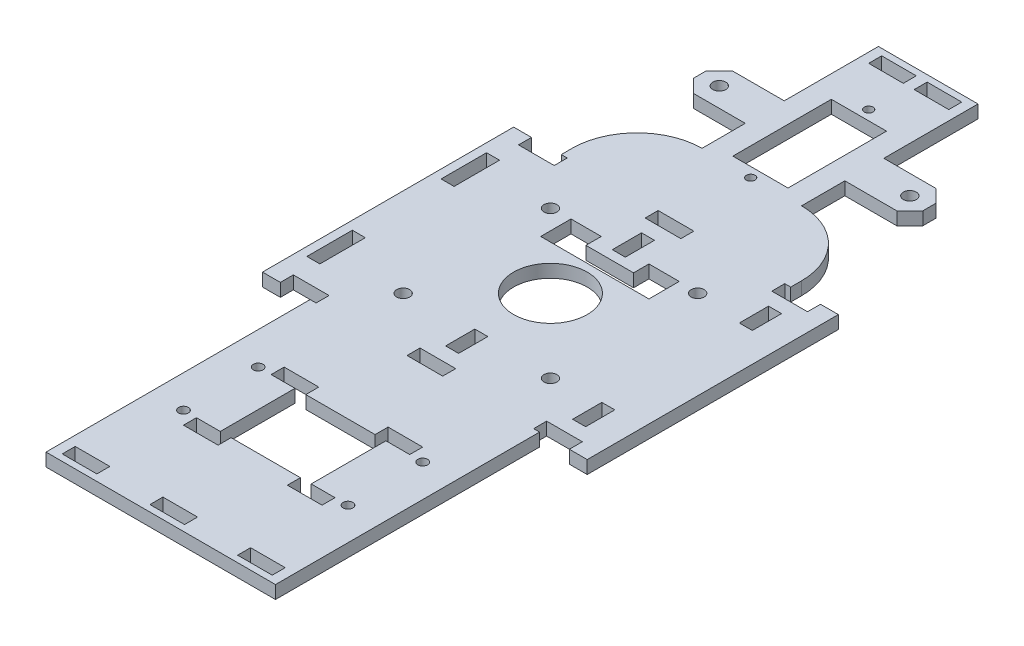
from build123d import *

# Parameters (mm, degrees)
SKETCH1_W            = 53
SKETCH1_H            = 153
BOSS_EXTRUDE1_DEPTH  = 3
SKETCH2_R            = 1.125
CUT_EXTRUDE1_DEPTH   = 3
SKETCH4_W            = 58
SKETCH4_H            = 3
BOSS_EXTRUDE3_DEPTH  = 4.5
SKETCH5_W            = 58
SKETCH5_H            = 3
BOSS_EXTRUDE4_DEPTH  = 4.5
SKETCH8_W            = 15
SKETCH8_H            = 13.5
CUT_EXTRUDE3_DEPTH   = 3
SKETCH9_W            = 6
SKETCH9_H            = 9
CUT_EXTRUDE4_DEPTH   = 3
SKETCH10_W           = 15
SKETCH10_H           = 10
CUT_EXTRUDE5_DEPTH   = 3
SKETCH11_W           = 12.75
SKETCH11_H           = 22.75
CUT_EXTRUDE6_DEPTH   = 3
SKETCH12_R           = 1
CUT_EXTRUDE7_DEPTH   = 3
SKETCH17_W           = 9
SKETCH17_H           = 3
BOSS_EXTRUDE6_DEPTH  = 6
SKETCH18_W           = 9
SKETCH18_H           = 3
BOSS_EXTRUDE8_DEPTH  = 6
SKETCH19_R           = 1.5
CUT_EXTRUDE11_DEPTH  = 3
SKETCH20_W           = 58
SKETCH20_H           = 3
BOSS_EXTRUDE9_DEPTH  = 6.5
SKETCH21_W           = 58
SKETCH21_H           = 3
BOSS_EXTRUDE10_DEPTH = 6.5
SKETCH29_W           = 8
SKETCH29_H           = 3
CUT_EXTRUDE15_DEPTH  = 3
SKETCH33_W           = 21
SKETCH33_H           = 17.25
CUT_EXTRUDE20_DEPTH  = 3
CHAMFER1_SIZE        = 3
CHAMFER2_SIZE        = 3
CHAMFER3_SIZE        = 3
CHAMFER4_SIZE        = 3
SKETCH34_W           = 8.25
SKETCH34_H           = 3
CUT_EXTRUDE21_DEPTH  = 3
SKETCH35_W           = 3
SKETCH35_H           = 6.75
CUT_EXTRUDE22_DEPTH  = 3
SKETCH36_W           = 3
SKETCH36_H           = 6.75
CUT_EXTRUDE23_DEPTH  = 3
SKETCH37_W           = 3
SKETCH37_H           = 10.5
CUT_EXTRUDE24_DEPTH  = 3
FILLET1_R            = 15
FILLET2_R            = 15
SKETCH38_W           = 23
SKETCH38_H           = 3
BOSS_EXTRUDE12_DEPTH = 8.25
SKETCH39_W           = 8
SKETCH39_H           = 3
CUT_EXTRUDE25_DEPTH  = 3
SKETCH40_W           = 53
SKETCH40_H           = 3
BOSS_EXTRUDE13_DEPTH = 16
SKETCH41_W           = 8
SKETCH41_H           = 3
CUT_EXTRUDE26_DEPTH  = 3
SKETCH42_R           = 8.5
SKETCH42_R_2         = 1.5
CUT_EXTRUDE30_DEPTH  = 3


with BuildPart() as part:
    # Sketch1 → Boss-Extrude1 (new body)
    with BuildSketch(Plane(origin=(0, 0, 0), x_dir=(1, 0, 0), z_dir=(0, 1, 0))):
        with Locations((13.558181818, 0)):
            Rectangle(SKETCH1_W, SKETCH1_H)
    extrude(amount=BOSS_EXTRUDE1_DEPTH)

    # Sketch2 → Cut-Extrude1 (cut)
    with BuildSketch(Plane(origin=(0, 3, 0), x_dir=(1, 0, 0), z_dir=(0, 1, 0))):
        with Locations(Location((-5.441818182, -68.25, 0), (0, 0, 270))):
            Circle(SKETCH2_R)
        with Locations(Location((-5.441818182, -51, 0), (0, 0, 270))):
            Circle(SKETCH2_R)
        with Locations(Location((32.558181818, -68.25, 0), (0, 0, 270))):
            Circle(SKETCH2_R)
        with Locations(Location((32.558181818, -51, 0), (0, 0, 270))):
            Circle(SKETCH2_R)
    extrude(amount=-CUT_EXTRUDE1_DEPTH, mode=Mode.SUBTRACT)

    # Sketch4 → Boss-Extrude3 (add)
    with BuildSketch(Plane(origin=(40.058181818, 0, 0), x_dir=(0, 0, -1), z_dir=(1, 0, 0))):
        with Locations((-2.5, 1.5)):
            Rectangle(SKETCH4_W, SKETCH4_H)
    extrude(amount=BOSS_EXTRUDE3_DEPTH)

    # Sketch5 → Boss-Extrude4 (add)
    with BuildSketch(Plane.ZY.offset(12.941818182)):
        with Locations((2.5, 1.5)):
            Rectangle(SKETCH5_W, SKETCH5_H)
    extrude(amount=BOSS_EXTRUDE4_DEPTH)

    # Sketch8 → Cut-Extrude3 (cut)
    with BuildSketch(Plane(origin=(0, 3, 0), x_dir=(1, 0, 0), z_dir=(0, 1, 0))):
        with Locations((-5.441818182, 69.75)):
            Rectangle(SKETCH8_W, SKETCH8_H)
        with Locations((32.558181818, 69.75)):
            Rectangle(SKETCH8_W, SKETCH8_H)
    extrude(amount=-CUT_EXTRUDE3_DEPTH, mode=Mode.SUBTRACT)

    # Sketch9 → Cut-Extrude4 (cut)
    with BuildSketch(Plane(origin=(0, 3, 0), x_dir=(1, 0, 0), z_dir=(0, 1, 0))):
        with Locations((-9.941818182, 58.5)):
            Rectangle(SKETCH9_W, SKETCH9_H)
        with Locations((37.058181818, 58.5)):
            Rectangle(SKETCH9_W, SKETCH9_H)
    extrude(amount=-CUT_EXTRUDE4_DEPTH, mode=Mode.SUBTRACT)

    # Sketch10 → Cut-Extrude5 (cut)
    with BuildSketch(Plane(origin=(0, 3, 0), x_dir=(1, 0, 0), z_dir=(0, 1, 0))):
        with Locations((-5.441818182, 49)):
            Rectangle(SKETCH10_W, SKETCH10_H)
        with Locations((32.558181818, 49)):
            Rectangle(SKETCH10_W, SKETCH10_H)
    extrude(amount=-CUT_EXTRUDE5_DEPTH, mode=Mode.SUBTRACT)

    # Sketch11 → Cut-Extrude6 (cut)
    with BuildSketch(Plane(origin=(0, 3, 0), x_dir=(1, 0, 0), z_dir=(0, 1, 0))):
        with Locations((13.558181818, 57.375)):
            Rectangle(SKETCH11_W, SKETCH11_H)
    extrude(amount=-CUT_EXTRUDE6_DEPTH, mode=Mode.SUBTRACT)

    # Sketch12 → Cut-Extrude7 (cut)
    with BuildSketch(Plane(origin=(0, 3, 0), x_dir=(1, 0, 0), z_dir=(0, 1, 0))):
        with Locations(Location((13.558181818, 71, 0), (0, 0, 270))):
            Circle(SKETCH12_R)
        with Locations(Location((13.558181818, 43.75, 0), (0, 0, 270))):
            Circle(SKETCH12_R)
    extrude(amount=-CUT_EXTRUDE7_DEPTH, mode=Mode.SUBTRACT)

    # Sketch17 → Boss-Extrude6 (add)
    with BuildSketch(Plane.ZY.offset(6.941818182)):
        with Locations((-58.5, 1.5)):
            Rectangle(SKETCH17_W, SKETCH17_H)
    extrude(amount=BOSS_EXTRUDE6_DEPTH)

    # Sketch18 → Boss-Extrude8 (add)
    with BuildSketch(Plane(origin=(34.058181818, 0, 0), x_dir=(0, 0, -1), z_dir=(1, 0, 0))):
        with Locations((58.5, 1.5)):
            Rectangle(SKETCH18_W, SKETCH18_H)
    extrude(amount=BOSS_EXTRUDE8_DEPTH)

    # Sketch19 → Cut-Extrude11 (cut)
    with BuildSketch(Plane(origin=(0, 3, 0), x_dir=(1, 0, 0), z_dir=(0, 1, 0))):
        with Locations(Location((35.558181818, 58.5, 0), (0, 0, 270))):
            Circle(SKETCH19_R)
        with Locations(Location((-8.441818182, 58.5, 0), (0, 0, 270))):
            Circle(SKETCH19_R)
    extrude(amount=-CUT_EXTRUDE11_DEPTH, mode=Mode.SUBTRACT)

    # Sketch20 → Boss-Extrude9 (add)
    with BuildSketch(Plane(origin=(44.558181818, 0, 0), x_dir=(0, 0, -1), z_dir=(1, 0, 0))):
        with Locations((-2.5, 1.5)):
            Rectangle(SKETCH20_W, SKETCH20_H)
    extrude(amount=BOSS_EXTRUDE9_DEPTH)

    # Sketch21 → Boss-Extrude10 (add)
    with BuildSketch(Plane.ZY.offset(17.441818182)):
        with Locations((2.5, 1.5)):
            Rectangle(SKETCH21_W, SKETCH21_H)
    extrude(amount=BOSS_EXTRUDE10_DEPTH)

    # Sketch29 → Cut-Extrude15 (cut)
    with BuildSketch(Plane(origin=(0, 3, 0), x_dir=(1, 0, 0), z_dir=(0, 1, 0))):
        with Locations((1.558181818, -49.5)):
            Rectangle(SKETCH29_W, SKETCH29_H)
        with Locations((1.558181818, -69.75)):
            Rectangle(SKETCH29_W, SKETCH29_H)
        with Locations((25.558181818, -49.5)):
            Rectangle(SKETCH29_W, SKETCH29_H)
        with Locations((25.558181818, -69.75)):
            Rectangle(SKETCH29_W, SKETCH29_H)
    extrude(amount=-CUT_EXTRUDE15_DEPTH, mode=Mode.SUBTRACT)

    # Sketch33 → Cut-Extrude20 (cut)
    with BuildSketch(Plane(origin=(0, 3, 0), x_dir=(1, 0, 0), z_dir=(0, 1, 0))):
        with Locations((13.558181818, -59.625)):
            Rectangle(SKETCH33_W, SKETCH33_H)
    extrude(amount=-CUT_EXTRUDE20_DEPTH, mode=Mode.SUBTRACT)

    # Chamfer1
    chamfer1_edges = [part.edges().sort_by_distance(p)[0] for p in [
        (-12.941818182, 1.5, -54),
    ]]
    chamfer(chamfer1_edges, length=CHAMFER1_SIZE)

    # Chamfer2
    chamfer2_edges = [part.edges().sort_by_distance(p)[0] for p in [
        (-12.941818182, 1.5, -63),
    ]]
    chamfer(chamfer2_edges, length=CHAMFER2_SIZE)

    # Chamfer3
    chamfer3_edges = [part.edges().sort_by_distance(p)[0] for p in [
        (40.058181818, 1.5, -54),
    ]]
    chamfer(chamfer3_edges, length=CHAMFER3_SIZE)

    # Chamfer4
    chamfer4_edges = [part.edges().sort_by_distance(p)[0] for p in [
        (40.058181818, 1.5, -63),
    ]]
    chamfer(chamfer4_edges, length=CHAMFER4_SIZE)

    # Sketch34 → Cut-Extrude21 (cut)
    with BuildSketch(Plane(origin=(0, 3, 0), x_dir=(1, 0, 0), z_dir=(0, 1, 0))):
        with Locations((-15.691818182, 25)):
            Rectangle(SKETCH34_W, SKETCH34_H)
        with Locations((42.808181818, 25)):
            Rectangle(SKETCH34_W, SKETCH34_H)
        with Locations((-15.691818182, -30)):
            Rectangle(SKETCH34_W, SKETCH34_H)
        with Locations((42.808181818, -30)):
            Rectangle(SKETCH34_W, SKETCH34_H)
        with Locations((13.558181818, -30)):
            Rectangle(SKETCH34_W, SKETCH34_H)
        with Locations((13.558181818, 25)):
            Rectangle(SKETCH34_W, SKETCH34_H)
    extrude(amount=-CUT_EXTRUDE21_DEPTH, mode=Mode.SUBTRACT)

    # Sketch35 → Cut-Extrude22 (cut)
    with BuildSketch(Plane(origin=(0, 3, 0), x_dir=(1, 0, 0), z_dir=(0, 1, 0))):
        with Locations((42.808181818, 16.75)):
            Rectangle(SKETCH35_W, SKETCH35_H)
        with Locations((42.808181818, -21.75)):
            Rectangle(SKETCH35_W, SKETCH35_H)
    extrude(amount=-CUT_EXTRUDE22_DEPTH, mode=Mode.SUBTRACT)

    # Sketch36 → Cut-Extrude23 (cut)
    with BuildSketch(Plane(origin=(0, 3, 0), x_dir=(1, 0, 0), z_dir=(0, 1, 0))):
        with Locations((13.474653765, 16.75)):
            Rectangle(SKETCH36_W, SKETCH36_H)
        with Locations((13.474653765, -21.75)):
            Rectangle(SKETCH36_W, SKETCH36_H)
    extrude(amount=-CUT_EXTRUDE23_DEPTH, mode=Mode.SUBTRACT)

    # Sketch37 → Cut-Extrude24 (cut)
    with BuildSketch(Plane(origin=(0, 3, 0), x_dir=(1, 0, 0), z_dir=(0, 1, 0))):
        with Locations((-20.441818182, 13)):
            Rectangle(SKETCH37_W, SKETCH37_H)
        with Locations((-20.441818182, -18)):
            Rectangle(SKETCH37_W, SKETCH37_H)
    extrude(amount=-CUT_EXTRUDE24_DEPTH, mode=Mode.SUBTRACT)

    # Fillet1
    fillet1_edges = [part.edges().sort_by_distance(p)[0] for p in [
        (-12.941818182, 1.5, -44),
    ]]
    fillet(fillet1_edges, radius=FILLET1_R - 0.0001)  # a hair under: the kernel refuses the full size

    # Fillet2
    fillet2_edges = [part.edges().sort_by_distance(p)[0] for p in [
        (40.058181818, 1.5, -44),
    ]]
    fillet(fillet2_edges, radius=FILLET2_R - 0.0001)  # a hair under: the kernel refuses the full size

    # Sketch38 → Boss-Extrude12 (add)
    with BuildSketch(Plane(origin=(0, 0, -76.5), x_dir=(-1, 0, 0), z_dir=(0, 0, -1))):
        with Locations((-13.558181818, 1.5)):
            Rectangle(SKETCH38_W, SKETCH38_H)
    extrude(amount=BOSS_EXTRUDE12_DEPTH)

    # Sketch39 → Cut-Extrude25 (cut)
    with BuildSketch(Plane(origin=(0, 0, 0), x_dir=(-1, 0, 0), z_dir=(0, -1, 0))):
        with Locations((-8.308181818, 81.75)):
            Rectangle(SKETCH39_W, SKETCH39_H)
        with Locations((-18.808181818, 81.75)):
            Rectangle(SKETCH39_W, SKETCH39_H)
    extrude(amount=-CUT_EXTRUDE25_DEPTH, mode=Mode.SUBTRACT)

    # Sketch40 → Boss-Extrude13 (add)
    with BuildSketch(Plane.XY.offset(76.5)):
        with Locations((13.558181818, 1.5)):
            Rectangle(SKETCH40_W, SKETCH40_H)
    extrude(amount=BOSS_EXTRUDE13_DEPTH)

    # Sketch41 → Cut-Extrude26 (cut)
    with BuildSketch(Plane(origin=(0, 3, 0), x_dir=(1, 0, 0), z_dir=(0, 1, 0))):
        with Locations((-6.691818182, -89.5)):
            Rectangle(SKETCH41_W, SKETCH41_H)
        with Locations((33.808181818, -89.5)):
            Rectangle(SKETCH41_W, SKETCH41_H)
        with Locations((13.558181818, -89.5)):
            Rectangle(SKETCH41_W, SKETCH41_H)
    extrude(amount=-CUT_EXTRUDE26_DEPTH, mode=Mode.SUBTRACT)

    # Sketch42 → Cut-Extrude30 (cut)
    with BuildSketch(Plane(origin=(0, 3, 0), x_dir=(1, 0, 0), z_dir=(0, 1, 0))):
        with Locations(Location((13.558181818, -2.5, 0), (0, 0, 270))):
            Circle(SKETCH42_R)
        with Locations(Location((30.558181818, 14.5, 0), (0, 0, 270))):
            Circle(SKETCH42_R_2)
        with Locations(Location((-3.441818182, 14.5, 0), (0, 0, 270))):
            Circle(SKETCH42_R_2)
        with Locations(Location((-3.441818182, -19.5, 0), (0, 0, 270))):
            Circle(SKETCH42_R_2)
        with Locations(Location((30.558181818, -19.5, 0), (0, 0, 270))):
            Circle(SKETCH42_R_2)
        Polygon((8.058181818, 14.75), (8.058181818, 11.194345135), (19.058181818, 11.194345135), (19.058181818, 14.75), (26.058181818, 14.75), (26.058181818, 7.75), (1.058181818, 7.75), (1.058181818, 14.75), align=None)
    extrude(amount=-CUT_EXTRUDE30_DEPTH, mode=Mode.SUBTRACT)


solid = part.part
